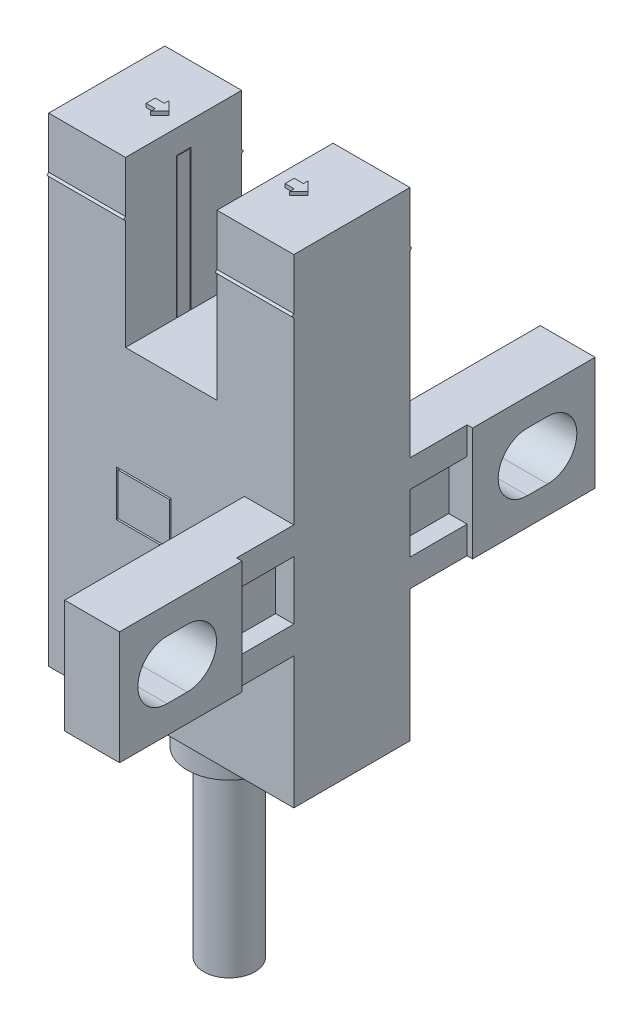
from build123d import *

# Parameters (mm, degrees)
BOSS_EXTRUDE1_DEPTH  = 4.2
SKETCH2_W            = 6.35
SKETCH2_H            = 17.2
BOSS_EXTRUDE2_DEPTH  = 5
BOSS_EXTRUDE3_DEPTH  = 4.2
SKETCH4_W            = 0.8
SKETCH4_H            = 7.7
CUT_EXTRUDE1_DEPTH   = 0.5
SKETCH5_W            = 0.8
SKETCH5_H            = 7.7
CUT_EXTRUDE2_DEPTH   = 0.5
SKETCH6_W            = 2.7
SKETCH6_H            = 6.2
BOSS_EXTRUDE4_DEPTH  = 9.825
SKETCH7_W            = 6.7
SKETCH7_H            = 6.2
BOSS_EXTRUDE5_DEPTH  = 0.3
SKETCH8_W            = 3.13
SKETCH8_H            = 3.2
CUT_EXTRUDE3_DEPTH   = 1
SKETCH9_W            = 2.7
SKETCH9_H            = 6.2
BOSS_EXTRUDE6_DEPTH  = 9.825
SKETCH10_W           = 6.7
SKETCH10_H           = 6.2
BOSS_EXTRUDE7_DEPTH  = 0.3
SKETCH11_W           = 3.13
SKETCH11_H           = 3.2
CUT_EXTRUDE4_DEPTH   = 1
CUT_EXTRUDE5_DEPTH   = 30.55587928
CUT_EXTRUDE6_DEPTH   = 31.769302885
BOSS_EXTRUDE8_DEPTH  = 0.2
BOSS_EXTRUDE9_DEPTH  = 0.2
SKETCH16_W           = 3
SKETCH16_H           = 2.5
CUT_EXTRUDE7_DEPTH   = 0.5
SKETCH17_W           = 2.8
SKETCH17_H           = 2.3
BOSS_EXTRUDE10_DEPTH = 0.5
RIB1_START           = -0.35
RIB1_OUTLINE_W       = 0.5
RIB1_OUTLINE_H       = 7.65
RIB1_DEPTH           = 0.7
RIB2_START           = -0.35
RIB2_OUTLINE_W       = 0.5
RIB2_OUTLINE_H       = 7.65
RIB2_DEPTH           = 0.7


# Read off the part's stored shape, not the designer's step: Rib1, Rib2
with BuildPart() as part:
    # Sketch1 → Boss-Extrude1 (new body)
    with BuildSketch(Plane(origin=(-0.3, 0, 0), x_dir=(0, 0, -1), z_dir=(1, 0, 0))):
        Polygon((-12.775, 13), (-12.675, 12.9), (-12.675, -10.3), (-6.325, -10.3), (-6.325, 12.9), (-6.225, 13), (-6.325, 13.1), (-6.325, 15.9), (-12.675, 15.9), (-12.675, 13.1), align=None)
    extrude(amount=-BOSS_EXTRUDE1_DEPTH)

    # Sketch2 → Boss-Extrude2 (add)
    with BuildSketch(Plane.ZY.offset(4.5)):
        with Locations((9.5, -1.7)):
            Rectangle(SKETCH2_W, SKETCH2_H)
    extrude(amount=BOSS_EXTRUDE2_DEPTH)

    # Sketch3 → Boss-Extrude3 (add)
    with BuildSketch(Plane.ZY.offset(9.5)):
        Polygon((6.325, 13.1), (6.325, 15.9), (12.675, 15.9), (12.675, 13.1), (12.775, 13), (12.675, 12.9), (12.675, -10.3), (6.325, -10.3), (6.325, 12.9), (6.225, 13), align=None)
    extrude(amount=BOSS_EXTRUDE3_DEPTH)

    # Sketch4 → Cut-Extrude1 (cut)
    with BuildSketch(Plane(origin=(-9.5, 0, 0), x_dir=(0, 0, -1), z_dir=(1, 0, 0))):
        with Locations((-9.5, 10.75)):
            Rectangle(SKETCH4_W, SKETCH4_H)
    extrude(amount=-CUT_EXTRUDE1_DEPTH, mode=Mode.SUBTRACT)

    # Sketch5 → Cut-Extrude2 (cut)
    with BuildSketch(Plane.ZY.offset(4.5)):
        with Locations((9.5, 10.75)):
            Rectangle(SKETCH5_W, SKETCH5_H)
    extrude(amount=-CUT_EXTRUDE2_DEPTH, mode=Mode.SUBTRACT)

    # Sketch6 → Boss-Extrude4 (add)
    with BuildSketch(Plane.XY.offset(12.675)):
        with Locations((-1.65, 0)):
            Rectangle(SKETCH6_W, SKETCH6_H)
    extrude(amount=BOSS_EXTRUDE4_DEPTH)

    # Sketch7 → Boss-Extrude5 (add)
    with BuildSketch(Plane(origin=(-0.3, 0, 0), x_dir=(0, 0, -1), z_dir=(1, 0, 0))):
        with Locations((-19.15, 0)):
            Rectangle(SKETCH7_W, SKETCH7_H)
    extrude(amount=BOSS_EXTRUDE5_DEPTH)

    # Sketch8 → Cut-Extrude3 (cut)
    with BuildSketch(Plane(origin=(-0.3, 0, 0), x_dir=(0, 0, -1), z_dir=(1, 0, 0))):
        with Locations((-14.235, 0)):
            Rectangle(SKETCH8_W, SKETCH8_H)
    extrude(amount=-CUT_EXTRUDE3_DEPTH, mode=Mode.SUBTRACT)

    # Sketch9 → Boss-Extrude6 (add)
    with BuildSketch(Plane(origin=(0, 0, 6.325), x_dir=(-1, 0, 0), z_dir=(0, 0, -1))):
        with Locations((1.65, 0)):
            Rectangle(SKETCH9_W, SKETCH9_H)
    extrude(amount=BOSS_EXTRUDE6_DEPTH)

    # Sketch10 → Boss-Extrude7 (add)
    with BuildSketch(Plane(origin=(-0.3, 0, 0), x_dir=(0, 0, -1), z_dir=(1, 0, 0))):
        with Locations((0.15, 0)):
            Rectangle(SKETCH10_W, SKETCH10_H)
    extrude(amount=BOSS_EXTRUDE7_DEPTH)

    # Sketch11 → Cut-Extrude4 (cut)
    with BuildSketch(Plane(origin=(-0.3, 0, 0), x_dir=(0, 0, -1), z_dir=(1, 0, 0))):
        with Locations((-4.765, 0)):
            Rectangle(SKETCH11_W, SKETCH11_H)
    extrude(amount=-CUT_EXTRUDE4_DEPTH, mode=Mode.SUBTRACT)

    # Sketch12 → Cut-Extrude5 (cut, through all)
    with BuildSketch(Plane.ZY.offset(3)):
        with BuildLine():
            Line((18.8, -1.6), (19.9, -1.6))
            ThreePointArc((19.9, -1.6), (21.5, 0), (19.9, 1.6))
            Line((19.9, 1.6), (18.8, 1.6))
            ThreePointArc((18.8, 1.6), (17.2, 0), (18.8, -1.6))
        make_face()
    extrude(amount=-CUT_EXTRUDE5_DEPTH, mode=Mode.SUBTRACT)

    # Sketch13 → Cut-Extrude6 (cut, through all)
    with BuildSketch(Plane(origin=(0, 0, 0), x_dir=(0, 0, -1), z_dir=(1, 0, 0))):
        with BuildLine():
            Line((-0.2, -1.6), (0.9, -1.6))
            ThreePointArc((0.9, -1.6), (2.5, 0), (0.9, 1.6))
            Line((0.9, 1.6), (-0.2, 1.6))
            ThreePointArc((-0.2, 1.6), (-1.8, 0), (-0.2, -1.6))
        make_face()
    extrude(amount=-CUT_EXTRUDE6_DEPTH, mode=Mode.SUBTRACT)

    # Sketch14 → Boss-Extrude8 (add)
    with BuildSketch(Plane(origin=(0, 15.9, 0), x_dir=(-1, 0, 0), z_dir=(0, 1, 0))):
        Polygon((10.8, 10), (10.8, 9.75), (11.3, 9.75), (11.3, 9.25), (10.8, 9.25), (10.8, 9), (10.3, 9.5), align=None)
    extrude(amount=BOSS_EXTRUDE8_DEPTH)

    # Sketch15 → Boss-Extrude9 (add)
    with BuildSketch(Plane(origin=(0, 15.9, 0), x_dir=(-1, 0, 0), z_dir=(0, 1, 0))):
        Polygon((3.2, 10), (3.2, 9.75), (3.7, 9.75), (3.7, 9.25), (3.2, 9.25), (3.2, 9), (2.7, 9.5), align=None)
    extrude(amount=BOSS_EXTRUDE9_DEPTH)

    # Sketch16 → Cut-Extrude7 (cut)
    with BuildSketch(Plane.XY.offset(12.675)):
        with Locations((-8.5, -0.25)):
            Rectangle(SKETCH16_W, SKETCH16_H)
    extrude(amount=-CUT_EXTRUDE7_DEPTH, mode=Mode.SUBTRACT)

    # Sketch17 → Boss-Extrude10 (add)
    with BuildSketch(Plane.XY.offset(12.175)):
        with Locations((-8.5, -0.25)):
            Rectangle(SKETCH17_W, SKETCH17_H)
    extrude(amount=BOSS_EXTRUDE10_DEPTH)

    # Sketch18 → Revolve1 (revolve)
    with BuildSketch(Plane(origin=(0, 0, 9.5), x_dir=(-1, 0, 0), z_dir=(0, 0, -1)), mode=Mode.PRIVATE) as revolve1_sk:
        Polygon((5.6, -22.3), (7, -22.3), (7, -10.3), (4.7, -10.3), (4.7, -12.3), (5.6, -12.3), align=None)
    revolve(revolve1_sk.sketch.rotate(Axis((-7, -22.3, 9.5), (0, 1, 0)), 180), axis=Axis((-7, -22.3, 9.5), (0, 1, 0)))

    # Rib1 outline → Rib1 (add)
    with BuildSketch(Plane(origin=(0, 0, 9.5), x_dir=(-1, 0, 0), z_dir=(0, 0, -1)).offset(RIB1_START)):
        with Locations((9.75, 10.725)):
            Rectangle(RIB1_OUTLINE_W, RIB1_OUTLINE_H)
    extrude(amount=RIB1_DEPTH)

    # Rib2 outline → Rib2 (add)
    with BuildSketch(Plane.XY.offset(9.5).offset(RIB2_START)):
        with Locations((-4.25, 10.725)):
            Rectangle(RIB2_OUTLINE_W, RIB2_OUTLINE_H)
    extrude(amount=RIB2_DEPTH)


solid = part.part
